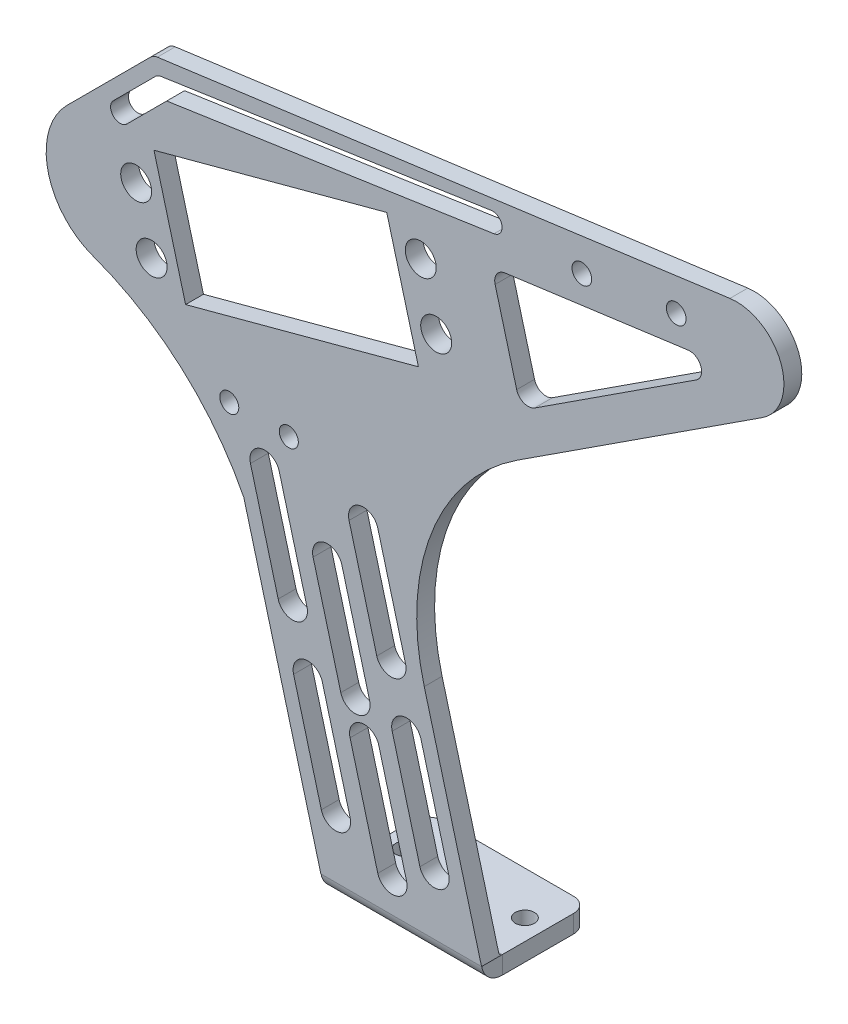
from build123d import *

# Parameters (mm, degrees)
EXTRUDE_1_DEPTH              = 3
EXTRUDE_2_DEPTH              = 120
CUT_EXTRUDE_1_DEPTH          = 195.561044405
SKETCH_9_R                   = 0.555167329
CUT_EXTRUDE_3_DEPTH          = 10
HOLE_WIZARD_M5_1_D           = 4.2
HOLE_WIZARD_M5_1_DEPTH       = 12.4
HOLE_WIZARD_M5_1_CSINK_D     = 5.05
HOLE_WIZARD_M5_1_CSINK_ANGLE = 90
HOLE_WIZARD_M5_1_TIP         = 1.2618073
SKETCH_12_R                  = 0.419228838
SKETCH_12_R_2                = 0.457437139
CUT_EXTRUDE_4_DEPTH          = 10
HOLE_WIZARD_M3_1_D           = 2.5
HOLE_WIZARD_M3_1_DEPTH       = 7.5
HOLE_WIZARD_M3_1_CSINK_D     = 3.05
HOLE_WIZARD_M3_1_CSINK_ANGLE = 90
HOLE_WIZARD_M3_1_TIP         = 0.751075774
SKETCH_31_W                  = 27
SKETCH_31_H                  = 3
CUT_EXTRUDE_7_DEPTH          = 18
SKETCH_42_R                  = 1.6
SKETCH_42_R_2                = 2.6
CUT_EXTRUDE_9_DEPTH          = 18
SKETCH_43_R                  = 1.65
CUT_EXTRUDE_10_DEPTH         = 18
SM_BASE_FLANGE_2_DEPTH       = 27
CUT_EXTRUDE_11_DEPTH         = 10
SKETCH_54_R                  = 1.6
CUT_EXTRUDE_12_DEPTH         = 10
CUT_EXTRUDE_13_DEPTH         = 153.01995181
CUT_EXTRUDE_14_DEPTH         = 153.01995181


# Sheet-metal steps are written as plain solids
with BuildPart() as part:
    # 草图2 → 凸台-拉伸1 (new body)
    with BuildSketch(Plane(origin=(0, 0, 0), x_dir=(1, 0, 0), z_dir=(0, 1, 0))):
        with BuildLine():
            Line((0, 0), (27, 0))
            Line((27, 0), (27, -16))
            ThreePointArc((27, -16), (26.414213562, -17.414213562), (25, -18))
            Line((25, -18), (2, -18))
            ThreePointArc((2, -18), (0.585786438, -17.414213562), (0, -16))
            Line((0, -16), (0, 0))
        make_face()
    extrude(amount=EXTRUDE_1_DEPTH)

    # Sketch 3 → 凸台-拉伸2 (add)
    with BuildSketch(Plane(origin=(0, 3, 0), x_dir=(1, 0, 0), z_dir=(0, 1, 0))):
        Polygon((0, 0), (150, 0), (150, -3), (-100, -3), (-100, 0), align=None)
    extrude(amount=EXTRUDE_2_DEPTH)

    # Sketch 4 → 切除-拉伸1 (cut, through all)
    with BuildSketch(Plane.XY.offset(3)):
        with BuildLine():
            Line((-27.465625599, 108.090395999), (81.955038276, 122.874558425))
            ThreePointArc((81.955038276, 122.874558425), (87.311898998, 119.659835192), (85.350748847, 113.728200311))
            Line((85.350748847, 113.728200311), (33.001315422, 79.678206183))
            ThreePointArc((33.001315422, 79.678206183), (18.570908538, 61.838352676), (17.374177378, 38.924059091))
            Line((17.374177378, 38.924059091), (27, 3))
            Line((27, 3), (150, 3))
            Line((150, 3), (150, 123))
            Line((150, 123), (-100, 123))
            Line((-100, 123), (-100, 3))
            Line((-100, 3), (0, 3))
            Line((0, 3), (-12.940952255, 51.296291314))
            ThreePointArc((-12.940952255, 51.296291314), (-23.474992402, 64.922058411), (-38.267104772, 73.743676313))
            ThreePointArc((-38.267104772, 73.743676313), (-45.866257029, 82.424841396), (-42.634405947, 93.500259258))
            Line((-42.634405947, 93.500259258), (-28.612046307, 107.522618899))
            ThreePointArc((-28.612046307, 107.522618899), (-28.085458288, 107.900644409), (-27.465625599, 108.090395999))
        make_face()
    extrude(amount=-CUT_EXTRUDE_1_DEPTH, mode=Mode.SUBTRACT)

    # 草图9 → 切除-拉伸3 (cut)
    with BuildSketch(Plane.XY.offset(3)):
        with Locations((-28.427787155, 78.364928444)):
            Circle(SKETCH_9_R)
        with Locations((-31.021767983, 88.02263332)):
            Circle(SKETCH_9_R)
        with Locations((19.37785198, 91.205133539)):
            Circle(SKETCH_9_R)
        with Locations((16.783871152, 100.862838415)):
            Circle(SKETCH_9_R)
        Polygon((-22.719980027, 74.461924756), (-28.037640723, 94.260219752), (11.076064024, 104.765842103), (16.39372472, 84.967547107), align=None)
    extrude(amount=-CUT_EXTRUDE_3_DEPTH, mode=Mode.SUBTRACT)

    # M5 螺纹孔1
    with Locations(Plane.XY.offset(3)):
        with Locations((-31.021767983, 88.02263332), (-28.427787155, 78.364928444), (16.783871152, 100.862838415), (19.37785198, 91.205133539)):
            CounterSinkHole(HOLE_WIZARD_M5_1_D / 2, HOLE_WIZARD_M5_1_CSINK_D / 2, depth=HOLE_WIZARD_M5_1_DEPTH, counter_sink_angle=HOLE_WIZARD_M5_1_CSINK_ANGLE)
            with Locations((0, 0, -(HOLE_WIZARD_M5_1_DEPTH + HOLE_WIZARD_M5_1_TIP / 2))):  # 118° drill point
                Cone(0, HOLE_WIZARD_M5_1_D / 2, HOLE_WIZARD_M5_1_TIP, mode=Mode.SUBTRACT)

    # 草图12 → 切除-拉伸4 (cut)
    with BuildSketch(Plane.XY.offset(3)):
        with Locations((-5.383085829, 63.900528175)):
            Circle(SKETCH_12_R)
        with Locations((-15.383085829, 63.900528175)):
            Circle(SKETCH_12_R_2)
        Polygon((-27.731348581, 94.083626651), (10.899470923, 104.45954996), (16.087432577, 85.144140208), (-22.543386926, 74.768216899), align=None)
    extrude(amount=-CUT_EXTRUDE_4_DEPTH, mode=Mode.SUBTRACT)

    # M3 螺纹孔1
    with Locations(Plane.XY.offset(3)):
        with Locations((-15.383085829, 63.900528175), (-5.383085829, 63.900528175)):
            CounterSinkHole(HOLE_WIZARD_M3_1_D / 2, HOLE_WIZARD_M3_1_CSINK_D / 2, depth=HOLE_WIZARD_M3_1_DEPTH, counter_sink_angle=HOLE_WIZARD_M3_1_CSINK_ANGLE)
            with Locations((0, 0, -(HOLE_WIZARD_M3_1_DEPTH + HOLE_WIZARD_M3_1_TIP / 2))):  # 118° drill point
                Cone(0, HOLE_WIZARD_M3_1_D / 2, HOLE_WIZARD_M3_1_TIP, mode=Mode.SUBTRACT)

    # 草图31 → 切除-拉伸7 (cut)
    with BuildSketch(Plane(origin=(0, 0, 0), x_dir=(-1, 0, 0), z_dir=(0, 0, -1))):
        with Locations((-13.5, 1.5)):
            Rectangle(SKETCH_31_W, SKETCH_31_H)
    extrude(amount=-CUT_EXTRUDE_7_DEPTH, mode=Mode.SUBTRACT)

    # 草图42 → 切除-拉伸9 (cut)
    with BuildSketch(Plane.XY.offset(3)):
        with Locations((-15.383085829, 63.900528175)):
            Circle(SKETCH_42_R)
        with Locations((-5.383085829, 63.900528175)):
            Circle(SKETCH_42_R)
        with Locations((-28.427787155, 78.364928444)):
            Circle(SKETCH_42_R_2)
        with Locations((-31.021767983, 88.02263332)):
            Circle(SKETCH_42_R_2)
        with Locations((16.783871152, 100.862838415)):
            Circle(SKETCH_42_R_2)
        with Locations((19.37785198, 91.205133539)):
            Circle(SKETCH_42_R_2)
        with BuildLine():
            Line((11.987750487, 29.73961726), (16.646493299, 12.352952387))
            ThreePointArc((16.646493299, 12.352952387), (19.708355477, 10.585185434), (21.47612243, 13.647047613))
            Line((21.47612243, 13.647047613), (16.817379618, 31.033712486))
            ThreePointArc((16.817379618, 31.033712486), (13.75551744, 32.801479439), (11.987750487, 29.73961726))
        make_face()
        with BuildLine():
            Line((-11.823601663, 56.785540397), (-7.164858851, 39.398875523))
            ThreePointArc((-7.164858851, 39.398875523), (-4.102996672, 37.63110857), (-2.335229719, 40.692970749))
            Line((-2.335229719, 40.692970749), (-6.993972531, 58.079635622))
            ThreePointArc((-6.993972531, 58.079635622), (-10.05583471, 59.847402575), (-11.823601663, 56.785540397))
        make_face()
        with BuildLine():
            Line((-4.5766684, 29.73961726), (0.082074412, 12.352952387))
            ThreePointArc((0.082074412, 12.352952387), (3.14393659, 10.585185434), (4.911703543, 13.647047613))
            Line((4.911703543, 13.647047613), (0.252960732, 31.033712486))
            ThreePointArc((0.252960732, 31.033712486), (-2.808901447, 32.801479439), (-4.5766684, 29.73961726))
        make_face()
        with BuildLine():
            Line((-1.301722379, 48.426978761), (3.358398139, 31.035172218))
            ThreePointArc((3.358398139, 31.035172218), (6.420260317, 29.267405265), (8.18802727, 32.329267444))
            Line((8.18802727, 32.329267444), (3.527906752, 49.721073986))
            ThreePointArc((3.527906752, 49.721073986), (0.466044574, 51.488840939), (-1.301722379, 48.426978761))
        make_face()
        with BuildLine():
            Line((4.740817224, 56.785540397), (9.399560036, 39.398875523))
            ThreePointArc((9.399560036, 39.398875523), (12.461422214, 37.63110857), (14.229189167, 40.692970749))
            Line((14.229189167, 40.692970749), (9.570446355, 58.079635622))
            ThreePointArc((9.570446355, 58.079635622), (6.508584177, 59.847402575), (4.740817224, 56.785540397))
        make_face()
        with BuildLine():
            Line((4.911312409, 25.23961726), (9.570055221, 7.852952387))
            ThreePointArc((9.570055221, 7.852952387), (12.6319174, 6.085185434), (14.399684353, 9.147047613))
            Line((14.399684353, 9.147047613), (9.740941541, 26.533712486))
            ThreePointArc((9.740941541, 26.533712486), (6.679079362, 28.301479439), (4.911312409, 25.23961726))
        make_face()
    extrude(amount=-CUT_EXTRUDE_9_DEPTH, mode=Mode.SUBTRACT)

    # 草图43 → 切除-拉伸10 (cut)
    with BuildSketch(Plane.XY.offset(3)):
        with Locations((43.853289388, 112.252662001)):
            Circle(SKETCH_43_R)
        with Locations((59.70921469, 114.395004835)):
            Circle(SKETCH_43_R)
        with BuildLine():
            Line((-34.854948443, 98.060205677), (-27.783880632, 105.131273489))
            ThreePointArc((-27.783880632, 105.131273489), (-27.372130398, 105.428939436), (-26.887815625, 105.582505293))
            Line((-26.887815625, 105.582505293), (28.617983545, 113.835264655))
            ThreePointArc((28.617983545, 113.835264655), (30.435892042, 112.487967844), (29.088595231, 110.670059347))
            Line((29.088595231, 110.670059347), (-25.894680467, 102.494990254))
            Line((-25.894680467, 102.494990254), (-32.592206744, 95.797463977))
            ThreePointArc((-32.592206744, 95.797463977), (-34.854948443, 95.797463977), (-34.854948443, 98.060205677))
        make_face()
    extrude(amount=-CUT_EXTRUDE_10_DEPTH, mode=Mode.SUBTRACT)

    # 草图55 → 切除-拉伸13 (cut, through all)
    with BuildSketch(Plane.XY.offset(3)):
        with BuildLine():
            Line((61.704894996, 110.047634391), (30.943691051, 105.891393518))
            ThreePointArc((30.943691051, 105.891393518), (29.546325951, 105.017215559), (29.27994293, 103.39060669))
            Line((29.27994293, 103.39060669), (32.904446455, 89.896140965))
            ThreePointArc((32.904446455, 89.896140965), (34.120486844, 88.547302554), (35.926478804, 88.738384548))
            Line((35.926478804, 88.738384548), (63.063179225, 106.389091146))
            ThreePointArc((63.063179225, 106.389091146), (63.847639285, 108.761745098), (61.704894996, 110.047634391))
        make_face()
    extrude(amount=-CUT_EXTRUDE_13_DEPTH, mode=Mode.SUBTRACT)

    # 草图56 → 切除-拉伸14 (cut, through all)
    with BuildSketch(Plane.XY.offset(3)):
        with BuildLine():
            Line((85.350748847, 113.728200311), (74.167295897, 106.45407178))
            ThreePointArc((74.167295897, 106.45407178), (77.30513614, 115.944687589), (68.734158983, 121.088244762))
            Line((68.734158983, 121.088244762), (81.955038276, 122.874558425))
            ThreePointArc((81.955038276, 122.874558425), (87.311898998, 119.659835192), (85.350748847, 113.728200311))
        make_face()
    extrude(amount=-CUT_EXTRUDE_14_DEPTH, mode=Mode.SUBTRACT)


with BuildPart() as body_2:
    # 草图44 → 基体-法兰2 (new body)
    with BuildSketch(Plane(origin=(0, 0, 0), x_dir=(0, 0, -1), z_dir=(1, 0, 0))):
        with BuildLine():
            Line((-3, 6), (-3, 3.5))
            ThreePointArc((-3, 3.5), (-1.974873734, 1.025126266), (0.5, 0))
            Line((0.5, 0), (14.96623469, 0))
            Line((14.96623469, 0), (14.96623469, 3))
            Line((14.96623469, 3), (0.5, 3))
            ThreePointArc((0.5, 3), (0.146446609, 3.146446609), (0, 3.5))
            Line((0, 3.5), (0, 6))
            Line((0, 6), (-3, 6))
        make_face()
    extrude(amount=SM_BASE_FLANGE_2_DEPTH)

    # 草图53 → 切除-拉伸11 (cut)
    with BuildSketch(Plane.XY.offset(3)):
        Polygon((27, 3), (26.196152423, 6), (27, 6), align=None)
    extrude(amount=-CUT_EXTRUDE_11_DEPTH, mode=Mode.SUBTRACT)

    # 草图54 → 切除-拉伸12 (cut)
    with BuildSketch(Plane(origin=(0, 3, 0), x_dir=(1, 0, 0), z_dir=(0, 1, 0))):
        with Locations(Location((3.45, 7.733117345, 0), (0, 0, 270))):
            Circle(SKETCH_54_R)
        with Locations(Location((23.55, 7.733117345, 0), (0, 0, 270))):
            Circle(SKETCH_54_R)
        with Locations(Location((13.5, 7.733117345, 0), (0, 0, 270))):
            Circle(SKETCH_54_R)
        with BuildLine():
            Line((24.5, 14.96623469), (27, 14.96623469))
            Line((27, 14.96623469), (27, 12.46623469))
            ThreePointArc((27, 12.46623469), (26.267766953, 14.234001643), (24.5, 14.96623469))
        make_face()
        with BuildLine():
            Line((0, 14.96623469), (2.5, 14.96623469))
            ThreePointArc((2.5, 14.96623469), (0.732233047, 14.234001643), (0, 12.46623469))
            Line((0, 12.46623469), (0, 14.96623469))
        make_face()
    extrude(amount=-CUT_EXTRUDE_12_DEPTH, mode=Mode.SUBTRACT)


with BuildPart() as part_1:
    add(part.part)

    # Combine 1: union body 2
    add(body_2.part)


solid = part_1.part
